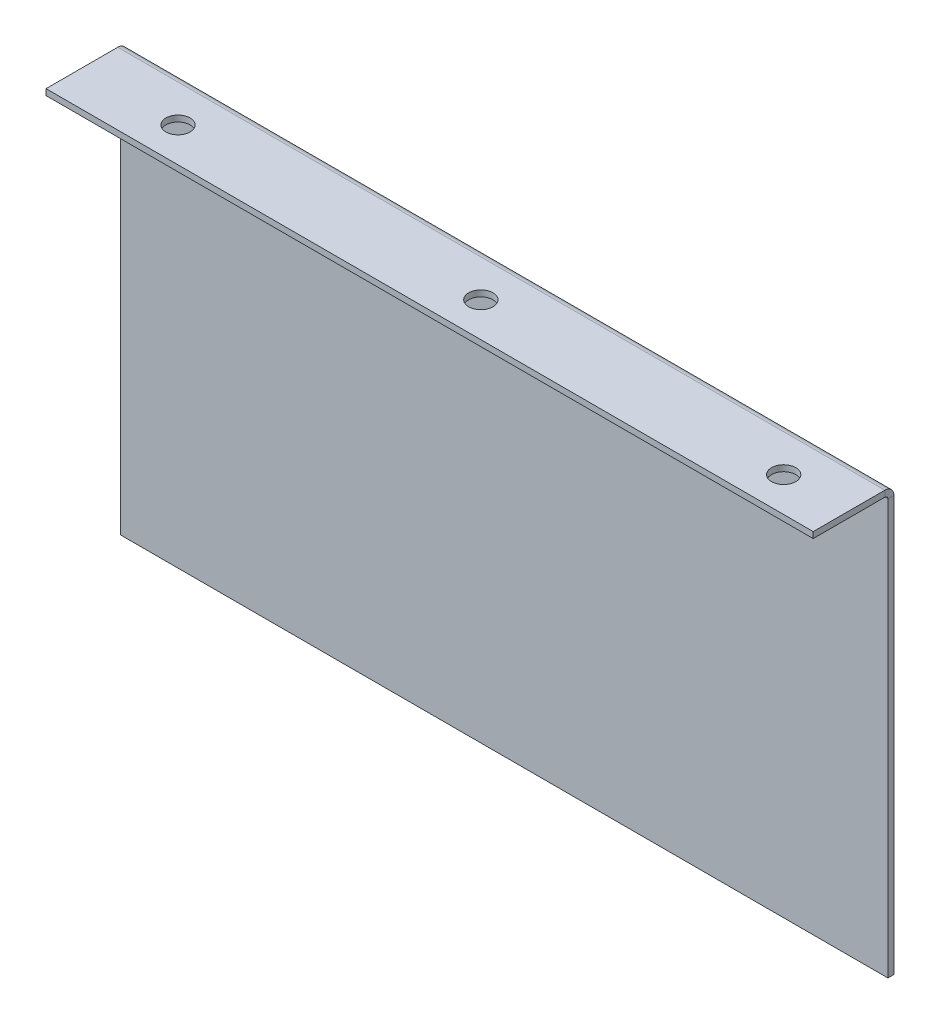
from build123d import *

# Parameters (mm, degrees)
SKETCH1_W                    = 190
SKETCH1_H                    = 105
BASE_FLANGE1_DEPTH           = 1.5
EDGE_FLANGE1_STRIP_W         = 7.4732
EDGE_FLANGE1_STRIP_H         = 1.5
EDGE_FLANGE1_STRIP_CUT_DEPTH = 190
EDGE_FLANGE1_DEPTH           = 190
SKETCH9_R                    = 3.004998415
CUT_EXTRUDE1_DEPTH           = 10
LPATTERN1_COUNT              = 3
LPATTERN1_PITCH              = 75


# Sheet-metal steps are written as plain solids
with BuildPart() as part:
    # Sketch1 → Base-Flange1 (new body)
    with BuildSketch(Plane.XY):
        with Locations((-7.105263158, -3.728070175)):
            Rectangle(SKETCH1_W, SKETCH1_H)
    extrude(amount=-BASE_FLANGE1_DEPTH)

    # Edge-Flange1 strip (across the edge) → Edge-Flange1 strip cut (cut)
    with BuildSketch(Plane(origin=(87.894736842, 48.771929825, 0), x_dir=(0, -1, 0), z_dir=(-1, 0, 0))):
        with Locations((-1.5, -0.75)):
            Rectangle(EDGE_FLANGE1_STRIP_W, EDGE_FLANGE1_STRIP_H)
    extrude(amount=EDGE_FLANGE1_STRIP_CUT_DEPTH, mode=Mode.SUBTRACT)

    # Edge-Flange1 section (across the edge) → Edge-Flange1 (add)
    with BuildSketch(Plane(origin=(87.894736842, 48.771929825, 0), x_dir=(0, -1, 0), z_dir=(-1, 0, 0))):
        with BuildLine():
            Line((0, 0.7366), (0, 18.5))
            Line((0, 18.5), (1.5, 18.5))
            Line((1.5, 18.5), (1.5, 0.7366))
            ThreePointArc((1.5, 0.7366), (1.715745145, 0.215745145), (2.2366, 0))
            Line((2.2366, 0), (2.2366, -1.5))
            ThreePointArc((2.2366, -1.5), (0.655084973, -0.844915027), (0, 0.7366))
        make_face()
    extrude(amount=EDGE_FLANGE1_DEPTH)

    # Sketch9 → Cut-Extrude1 (cut)
    with BuildSketch(Plane.XZ.offset(-47.271929825)):
        with Locations(Location((-77.977994627, 9.946382275, 0), (0, 0, 270))):
            Circle(SKETCH9_R)
    cut_extrude1 = extrude(amount=-CUT_EXTRUDE1_DEPTH, mode=Mode.SUBTRACT)

    # LPattern1: Cut-Extrude1 ×3
    with Locations(*[(i * LPATTERN1_PITCH, 0, 0) for i in range(1, LPATTERN1_COUNT)]):
        add(cut_extrude1, mode=Mode.SUBTRACT)


solid = part.part
